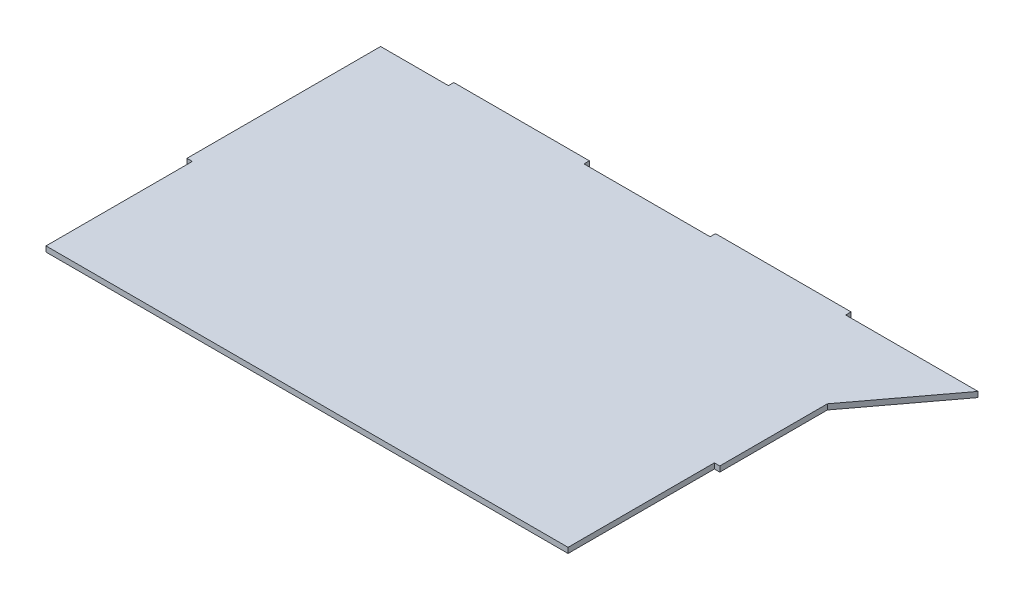
from build123d import *

# Parameters (mm, degrees)
SKETCH1_W           = 314.4612
SKETCH1_H           = 3.175
BOSS_EXTRUDE1_DEPTH = 200.66180012
CUT_EXTRUDE2_START  = -3.175
SKETCH5_W           = 3.175
SKETCH5_H           = 86.36
CUT_EXTRUDE2_DEPTH  = 259.119504214
SKETCH3_W           = 80
SKETCH3_H           = 3.175
BOSS_EXTRUDE2_DEPTH = 3.175
LPATTERN2_COUNT     = 2
LPATTERN2_PITCH     = 154.43
BOSS_EXTRUDE3_DEPTH = 3.175


with BuildPart() as part:
    # Sketch1 → Boss-Extrude1 (new body)
    with BuildSketch(Plane.XY):
        Rectangle(SKETCH1_W, SKETCH1_H)
    extrude(amount=BOSS_EXTRUDE1_DEPTH)

    # Sketch5 → Cut-Extrude2 (cut)
    with BuildSketch(Plane(origin=(0, 1.5875, 0), x_dir=(1, 0, 0), z_dir=(0, 1, 0)).offset(CUT_EXTRUDE2_START)):
        with Locations((-155.6431, -157.48180012)):
            Rectangle(SKETCH5_W, SKETCH5_H)
    cut_extrude2 = extrude(amount=CUT_EXTRUDE2_DEPTH, mode=Mode.SUBTRACT)

    # Mirror1: Cut-Extrude2 across plane
    add(cut_extrude2.mirror(Plane(origin=(0, 0, 0), x_dir=(0, 0, 1), z_dir=(1, 0, 0))), mode=Mode.SUBTRACT)

    # Sketch3 → Boss-Extrude2 (add)
    with BuildSketch(Plane(origin=(0, 0, 0), x_dir=(-1, 0, 0), z_dir=(0, 0, -1))):
        with Locations((-77.2306, 0)):
            Rectangle(SKETCH3_W, SKETCH3_H)
    boss_extrude2 = extrude(amount=BOSS_EXTRUDE2_DEPTH)

    # LPattern2: Boss-Extrude2 ×2
    with Locations(*[(-i * LPATTERN2_PITCH, 0, 0) for i in range(1, LPATTERN2_COUNT)]):
        add(boss_extrude2)

    # Sketch10 → Boss-Extrude3 (add)
    with BuildSketch(Plane.XZ.offset(1.5875)):
        Polygon((157.2306, 0), (195.3306, 0), (157.2306, 50.8), align=None)
    extrude(amount=-BOSS_EXTRUDE3_DEPTH)


solid = part.part
